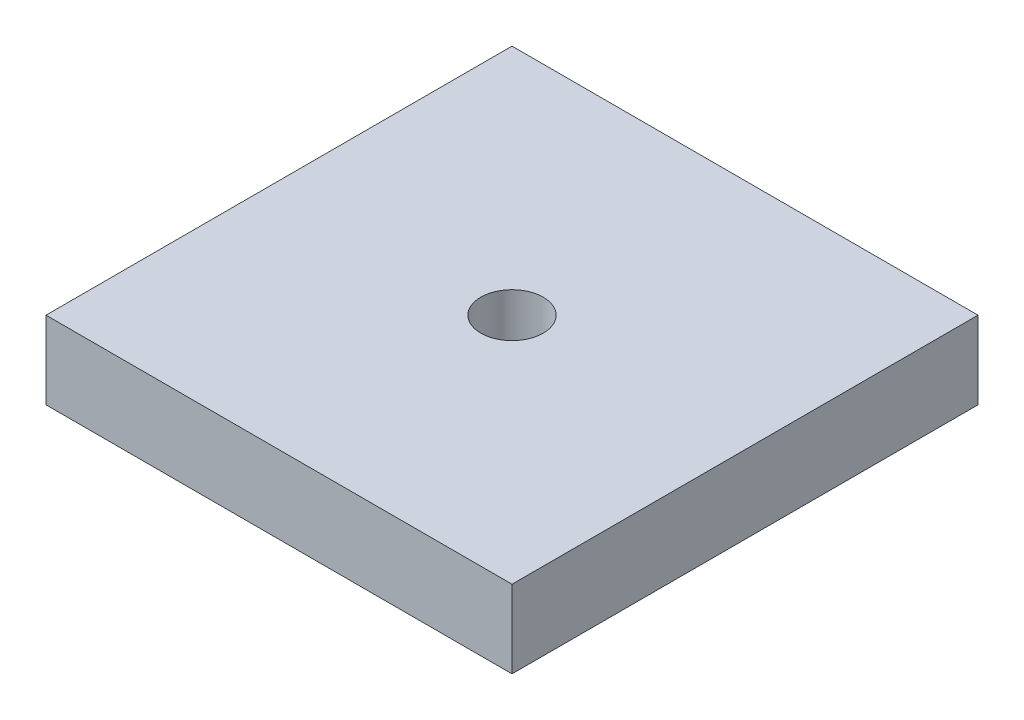
from build123d import *

# Parameters (mm, degrees)
SKETCH1_W                   = 38.1
SKETCH1_H                   = 38.1
BOSS_EXTRUDE1_DEPTH         = 6.35
F_1_4_20_TAPPED_HOLE1_D     = 5.1054
F_1_4_20_TAPPED_HOLE1_DEPTH = 16.51
F_1_4_20_TAPPED_HOLE1_TIP   = 1.533816902


with BuildPart() as part:
    # Sketch1 → Boss-Extrude1 (new body)
    with BuildSketch(Plane(origin=(0, 0, 0), x_dir=(1, 0, 0), z_dir=(0, 1, 0))):
        with Locations((19.05, 19.05)):
            Rectangle(SKETCH1_W, SKETCH1_H)
    extrude(amount=BOSS_EXTRUDE1_DEPTH)

    # 1/4-20 Tapped Hole1
    with Locations(Plane(origin=(0, 6.35, 0), x_dir=(1, 0, 0), z_dir=(0, 1, 0))):
        with Locations((19.05, 19.05)):
            Hole(F_1_4_20_TAPPED_HOLE1_D / 2, depth=F_1_4_20_TAPPED_HOLE1_DEPTH)
            with Locations((0, 0, -(F_1_4_20_TAPPED_HOLE1_DEPTH + F_1_4_20_TAPPED_HOLE1_TIP / 2))):  # 118° drill point
                Cone(0, F_1_4_20_TAPPED_HOLE1_D / 2, F_1_4_20_TAPPED_HOLE1_TIP, mode=Mode.SUBTRACT)


solid = part.part
